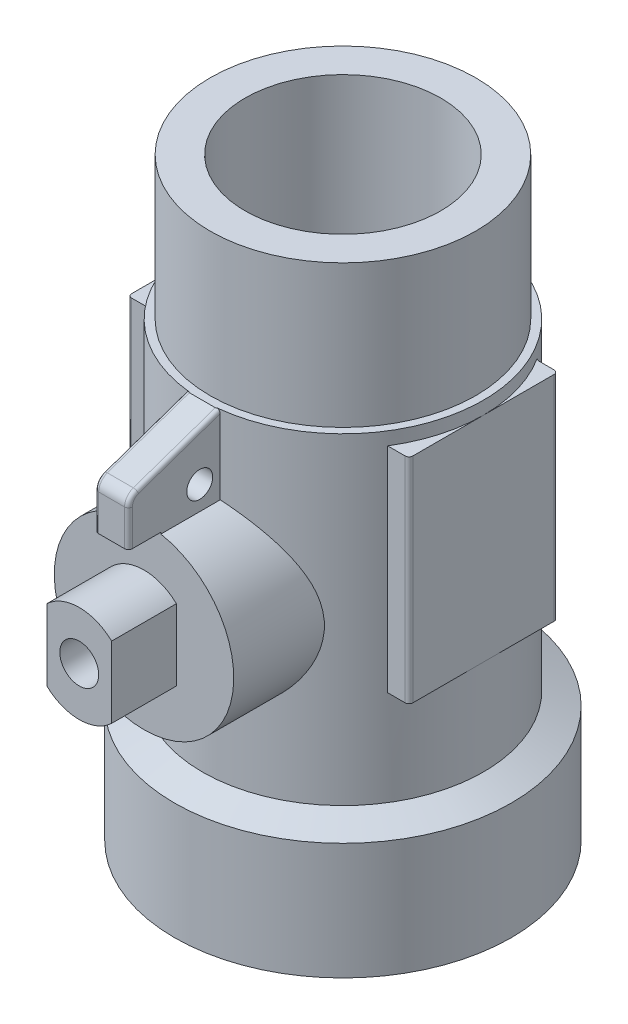
from build123d import *

# Parameters (mm, degrees)
SKETCH2_W                = 16.5
SKETCH2_H                = 11.5
BOSS_EXTRUDE1_DEPTH      = 2
BOSS_EXTRUDE2_DEPTH      = 4.5
BOSS_EXTRUDE2_DEPTH_BACK = 3
SKETCH3_R                = 6.925
BOSS_EXTRUDE6_DEPTH      = 1.3
BOSS_EXTRUDE6_DEPTH_BACK = 1.3
SKETCH4_R                = 1
FILLET2_R                = 0.3
FILLET4_R                = 0.3
FILLET7_R                = 0.3
FILLET8_R                = 0.3
FILLET9_R                = 0.3
FILLET10_R               = 0.3
FILLET11_R               = 0.3
FILLET12_R               = 0.3
SKETCH5_R                = 1.5
BOSS_EXTRUDE7_DEPTH      = 5
FILLET13_R               = 1


with BuildPart() as part:
    # Sketch1 → Revolve1 (revolve)
    with BuildSketch(Plane.XY, mode=Mode.PRIVATE) as revolve1_sk:
        Polygon((7.55, 45.85), (7.55, 33.85), (5, 32.85), (5, 28.85), (0, 28.85), (0, 12), (5, 12), (5, 7.7), (9, 7.7), (9, 0), (13, 0), (13, 9), (10.85, 10), (10.85, 34.85), (10.25, 34.85), (10.25, 45.85), align=None)
    revolve(revolve1_sk.sketch.rotate(Axis((0, 0, 0), (0, 1, 0)), 90), axis=Axis((0, 0, 0), (0, 1, 0)))

    # Sketch2 → Boss-Extrude1 (add)
    with BuildSketch(Plane.YZ.offset(10.85)):
        with Locations((25.6, 0)):
            Rectangle(SKETCH2_W, SKETCH2_H)
    boss_extrude1 = extrude(amount=-BOSS_EXTRUDE1_DEPTH)

    # Mirror1: Boss-Extrude1 across plane
    add(boss_extrude1.mirror(Plane(origin=(0, 0, 0), x_dir=(0, 0, 1), z_dir=(1, 0, 0))))

    # Sketch3 → Boss-Extrude2 (add, two sides: drawn at the far end of the back side and taken through both)
    with BuildSketch(Plane(origin=(0, 0, 10.85), x_dir=(0, -1, 0), z_dir=(0, 0, 1)).offset(-BOSS_EXTRUDE2_DEPTH_BACK)):
        with Locations(Location((-22, 0, 0), (0, 0, 90))):
            Circle(SKETCH3_R)
    extrude(amount=BOSS_EXTRUDE2_DEPTH + BOSS_EXTRUDE2_DEPTH_BACK)

    # Sketch4 → Boss-Extrude6 (add, two sides: drawn at the far end of the back side and taken through both)
    with BuildSketch(Plane(origin=(0, 0, 0), x_dir=(0, 0, -1), z_dir=(1, 0, 0)).offset(-BOSS_EXTRUDE6_DEPTH_BACK)):
        Polygon((-10.85, 34.85), (-17.85, 32.425), (-17.85, 28.925), (-15.35, 28.925), (-15.35, 27.925), (-10.25, 27.925), (-10.25, 34.85), align=None)
        with Locations((-12.35, 30.625)):
            Circle(SKETCH4_R, mode=Mode.SUBTRACT)
    extrude(amount=BOSS_EXTRUDE6_DEPTH + BOSS_EXTRUDE6_DEPTH_BACK)

    # Fillet2
    fillet2_edges = [part.edges().sort_by_distance(p)[0] for p in [
        (-9.201086892, 25.6, 5.75),
    ]]
    fillet(fillet2_edges, radius=FILLET2_R)

    # Fillet4
    fillet4_edges = [part.edges().sort_by_distance(p)[0] for p in [
        (10.85, 25.6, 5.75),
    ]]
    fillet(fillet4_edges, radius=FILLET4_R)

    # Fillet7
    fillet7_edges = [part.edges().sort_by_distance(p)[0] for p in [
        (10.85, 25.6, -5.75),
    ]]
    fillet(fillet7_edges, radius=FILLET7_R)

    # Fillet8
    fillet8_edges = [part.edges().sort_by_distance(p)[0] for p in [
        (-10.85, 25.6, -5.75),
    ]]
    fillet(fillet8_edges, radius=FILLET8_R)

    # Fillet9
    fillet9_edges = [part.edges().sort_by_distance(p)[0] for p in [
        (-10.85, 25.6, 5.75),
    ]]
    fillet(fillet9_edges, radius=FILLET9_R)

    # Fillet10
    # the kernel refuses this fillet: 0.3 mm, written as the material it takes off along each edge
    with BuildSketch(Plane(origin=(1.3, 33.175, 17.85), x_dir=(0, 0, -1), z_dir=(0, -1, 0))) as fillet10_piece_1:
        with BuildLine():
            CenterArc((FILLET10_R, -FILLET10_R), FILLET10_R, 90, 90)
            Line((0, -FILLET10_R), (0, 0))
            Line((0, 0), (FILLET10_R, 0))
        make_face()
    extrude(amount=5, mode=Mode.SUBTRACT)
    with BuildSketch(Plane(origin=(-1.3, 35.095506775, 10.141320648), x_dir=(0, -0.9449058020160995, -0.3273423671270065), z_dir=(0, -0.3273423671270065, 0.9449058020160995))) as fillet10_piece_2_section:
        with BuildLine():
            CenterArc((FILLET10_R, FILLET10_R), FILLET10_R, 180, 90)
            Line((0, FILLET10_R), (0, 0))
            Line((0, 0), (FILLET10_R, 0))
        make_face()
    fillet10_piece_2 = extrude(amount=8.908145854, mode=Mode.PRIVATE)
    fillet10_piece_2 = fillet10_piece_2 - Plane(origin=(0, 33.459049613, 0), x_dir=(0, 0, -1), z_dir=(0, 1, 0)) * Cylinder(10.85, 20, mode=Mode.PRIVATE)
    add(fillet10_piece_2, mode=Mode.SUBTRACT)
    with BuildSketch(Plane(origin=(-1.3, 33.175, 17.85), x_dir=(0, 0, -1), z_dir=(0, -1, 0))) as fillet10_piece_3:
        with BuildLine():
            CenterArc((FILLET10_R, FILLET10_R), FILLET10_R, 180, 90)
            Line((0, FILLET10_R), (0, 0))
            Line((0, 0), (FILLET10_R, 0))
        make_face()
    extrude(amount=5, mode=Mode.SUBTRACT)
    with BuildSketch(Plane(origin=(1.3, 35.095506775, 10.141320648), x_dir=(0, -0.9449058020160995, -0.3273423671270065), z_dir=(0, -0.3273423671270065, 0.9449058020160995))) as fillet10_piece_4_section:
        with BuildLine():
            CenterArc((FILLET10_R, -FILLET10_R), FILLET10_R, 90, 90)
            Line((0, -FILLET10_R), (0, 0))
            Line((0, 0), (FILLET10_R, 0))
        make_face()
    fillet10_piece_4 = extrude(amount=8.908145854, mode=Mode.PRIVATE)
    fillet10_piece_4 = fillet10_piece_4 - Plane(origin=(0, 33.459049613, 0), x_dir=(0, 0, -1), z_dir=(0, 1, 0)) * Cylinder(10.85, 20, mode=Mode.PRIVATE)
    add(fillet10_piece_4, mode=Mode.SUBTRACT)

    # Fillet11
    fillet11_edges = [part.edges().sort_by_distance(p)[0] for p in [
        (9.201086892, 25.6, -5.75),
    ]]
    fillet(fillet11_edges, radius=FILLET11_R)

    # Fillet12
    fillet12_edges = [part.edges().sort_by_distance(p)[0] for p in [
        (-9.201086892, 25.6, -5.75),
    ]]
    fillet(fillet12_edges, radius=FILLET12_R)

    # Sketch5 → Boss-Extrude7 (add)
    with BuildSketch(Plane.XY.offset(15.35)):
        with BuildLine():
            Line((-2.5, 19.25), (-2.5, 24.75))
            ThreePointArc((-2.5, 24.75), (0, 25.75), (2.5, 24.75))
            Line((2.5, 24.75), (2.5, 19.25))
            ThreePointArc((2.5, 19.25), (0, 18.25), (-2.5, 19.25))
        make_face()
        with Locations((0, 22)):
            Circle(SKETCH5_R, mode=Mode.SUBTRACT)
    extrude(amount=BOSS_EXTRUDE7_DEPTH)

    # Fillet13
    # the kernel refuses this fillet: 1 mm, written as the material it takes off along each edge
    with BuildSketch(Plane(origin=(-1.3, 31.713122021, 16.85), x_dir=(0, 0, 1), z_dir=(0, -1, 0))) as fillet13_piece_1:
        with BuildLine():
            CenterArc((0.7, -0.3), 0.3, 0, 90)
            Line((1, -0.3), (1, 0))
            Line((1, 0), (0.7, 0))
        make_face()
    revolve(axis=Axis((-1.3, 31.713122021, 16.85), (-1, 0, 0)), revolution_arc=70.892452859, mode=Mode.SUBTRACT)
    with BuildSketch(Plane(origin=(1.3, 31.713122021, 16.85), x_dir=(0, 0.9449058020160994, 0.32734236712700643), z_dir=(0, 0.32734236712700643, -0.9449058020160994))) as fillet13_piece_2:
        with BuildLine():
            CenterArc((0.7, -0.3), 0.3, 0, 90)
            Line((1, -0.3), (1, 0))
            Line((1, 0), (0.7, 0))
        make_face()
    revolve(axis=Axis((1.3, 31.713122021, 16.85), (1, 0, 0)), revolution_arc=70.892452859, mode=Mode.SUBTRACT)
    with BuildSketch(Plane(origin=(-1.3, 32.425, 17.85), x_dir=(0, 0.32734236712700615, -0.9449058020160995), z_dir=(1, 0, 0))) as fillet13_piece_3:
        with BuildLine():
            CenterArc((FILLET13_R * 0.711877979199, -FILLET13_R), FILLET13_R, 90, 70.892452859)
            Line((-FILLET13_R * 0.233027822817, -FILLET13_R * 0.672657632873), (0, 0))
            Line((0, 0), (FILLET13_R * 0.711877979199, 0))
        make_face()
    extrude(amount=2.6, mode=Mode.SUBTRACT)


solid = part.part
